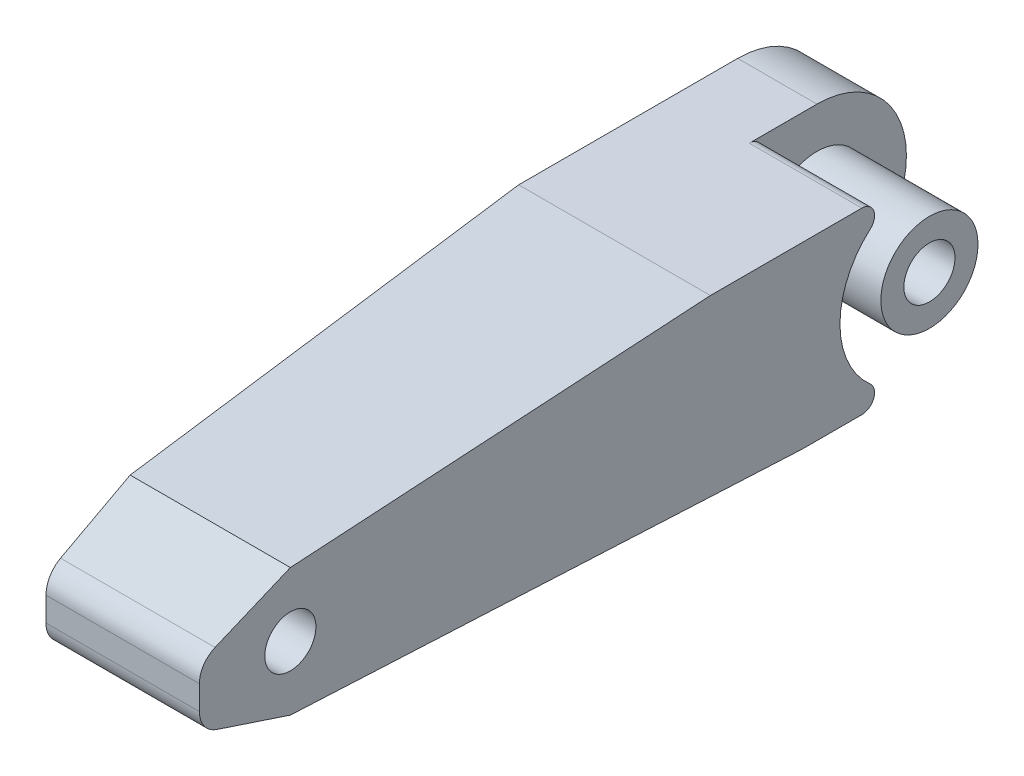
from build123d import *

# Parameters (mm, degrees)
BOSS_EXTRUDE1_DEPTH = 7.5
SKETCH2_R           = 3.5
CUT_EXTRUDE1_DEPTH  = 4.4
FILLET1_START       = -4.4
FILLET1_DEPTH       = 5.4
SKETCH3_R           = 1.9
BOSS_EXTRUDE2_DEPTH = 7.5
CUT_EXTRUDE2_REACH  = 21.056
SKETCH7_R           = 1
CUT_EXTRUDE3_DEPTH  = 7.5
CUT_EXTRUDE4_DEPTH  = 6


with BuildPart() as part:
    # Sketch1 → Boss-Extrude1 (new body)
    with BuildSketch(Plane(origin=(0, 0, 0), x_dir=(0, 0, -1), z_dir=(1, 0, 0))):
        with BuildLine():
            Line((12.5, -3.5), (7.528802268, -3.5))
            Line((7.528802268, -3.5), (-12.5, -2.5))
            Line((-12.5, -2.5), (-15.372715308, -1.549625261))
            ThreePointArc((-15.372715308, -1.549625261), (-15.869210997, -1.185856004), (-16.058629018, -0.600230821))
            Line((-16.058629018, -0.600230821), (-16.058629018, 0.344074306))
            ThreePointArc((-16.058629018, 0.344074306), (-15.891200042, 0.897992613), (-15.444978036, 1.26642697))
            Line((-15.444978036, 1.26642697), (-12.5, 2.5))
            Line((-12.5, 2.5), (3.930719529, 3.5))
            Line((3.930719529, 3.5), (12.5, 3.5))
            ThreePointArc((12.5, 3.5), (16, 0), (12.5, -3.5))
        make_face()
    extrude(amount=-BOSS_EXTRUDE1_DEPTH)

    # Sketch2 → Cut-Extrude1 (cut)
    with BuildSketch(Plane(origin=(0, 0, 0), x_dir=(0, 0, -1), z_dir=(1, 0, 0))):
        with Locations((12.5, 0)):
            Circle(SKETCH2_R)
    extrude(amount=-CUT_EXTRUDE1_DEPTH, mode=Mode.SUBTRACT)

    # Fillet1: read off the stored shape, not the designer's step
    # Fillet1 outline → Fillet1 (cut)
    with BuildSketch(Plane.YZ.offset(FILLET1_START)):
        with BuildLine():
            ThreePointArc((3.5, -9.854248689), (3.176776695, -10.321955862), (2.625, -10.184967603))
            ThreePointArc((2.625, -10.184967603), (3.273950213, -11.262563133), (3.5, -12.5))
            Line((3.5, -12.5), (3.5, -9.854248689))
        make_face()
        with BuildLine():
            ThreePointArc((-2.625, -10.184967603), (-3.176776695, -10.321955862), (-3.5, -9.854248689))
            Line((-3.5, -9.854248689), (-3.5, -12.5))
            ThreePointArc((-3.5, -12.5), (-3.273950213, -11.262563133), (-2.625, -10.184967603))
        make_face()
    extrude(amount=FILLET1_DEPTH, mode=Mode.SUBTRACT)

    # Sketch3 → Boss-Extrude2 (add)
    with BuildSketch(Plane.ZY.offset(7.5)):
        with Locations(Location((-12.5, 0, 0), (0, 0, 180))):
            Circle(SKETCH3_R)
    extrude(amount=-BOSS_EXTRUDE2_DEPTH)

    # Cut-Extrude2: up to this plane
    cut_extrude2_end = Plane(origin=(-7.5, -3.116332783, 0.155592568), z_dir=(0, 0.9987559179882337, -0.04986598322986022))
    # Sketch4 → Cut-Extrude2 (cut, up to the surface)
    with BuildSketch(Plane(origin=(0, 3.5, 0), x_dir=(1, 0, 0), z_dir=(0, 1, 0)), mode=Mode.PRIVATE) as cut_extrude2_sk1:
        Polygon((-7.5, -16.058629018), (-7.5, 3.930719529), (-6, -16.058629018), align=None)
    cut_extrude2_tool1 = split(extrude(cut_extrude2_sk1.sketch, amount=-CUT_EXTRUDE2_REACH, mode=Mode.PRIVATE), bisect_by=cut_extrude2_end, keep=Keep.BOTH, mode=Mode.PRIVATE)
    add(cut_extrude2_tool1.solids().sort_by_distance((-7, 3.5, 9.395513))[0], mode=Mode.SUBTRACT)

    # Sketch7 → Cut-Extrude3 (cut)
    with BuildSketch(Plane.ZY.offset(7.5)):
        with Locations((-12.5, 0)):
            Circle(SKETCH7_R)
        with Locations(Location((12.5, 0, 0), (0, 0, 180))):
            Circle(SKETCH7_R)
    extrude(amount=-CUT_EXTRUDE3_DEPTH, mode=Mode.SUBTRACT)

    # Sketch8 → Cut-Extrude4 (cut)
    with BuildSketch(Plane.ZY.offset(7.5)):
        Polygon((-11, 0), (-11.75, 1.299038106), (-13.25, 1.299038106), (-14, 0), (-13.25, -1.299038106), (-11.75, -1.299038106), align=None)
        Polygon((14, 0), (13.25, 1.299038106), (11.75, 1.299038106), (11, 0), (11.75, -1.299038106), (13.25, -1.299038106), align=None)
    extrude(amount=-CUT_EXTRUDE4_DEPTH, mode=Mode.SUBTRACT)


solid = part.part
